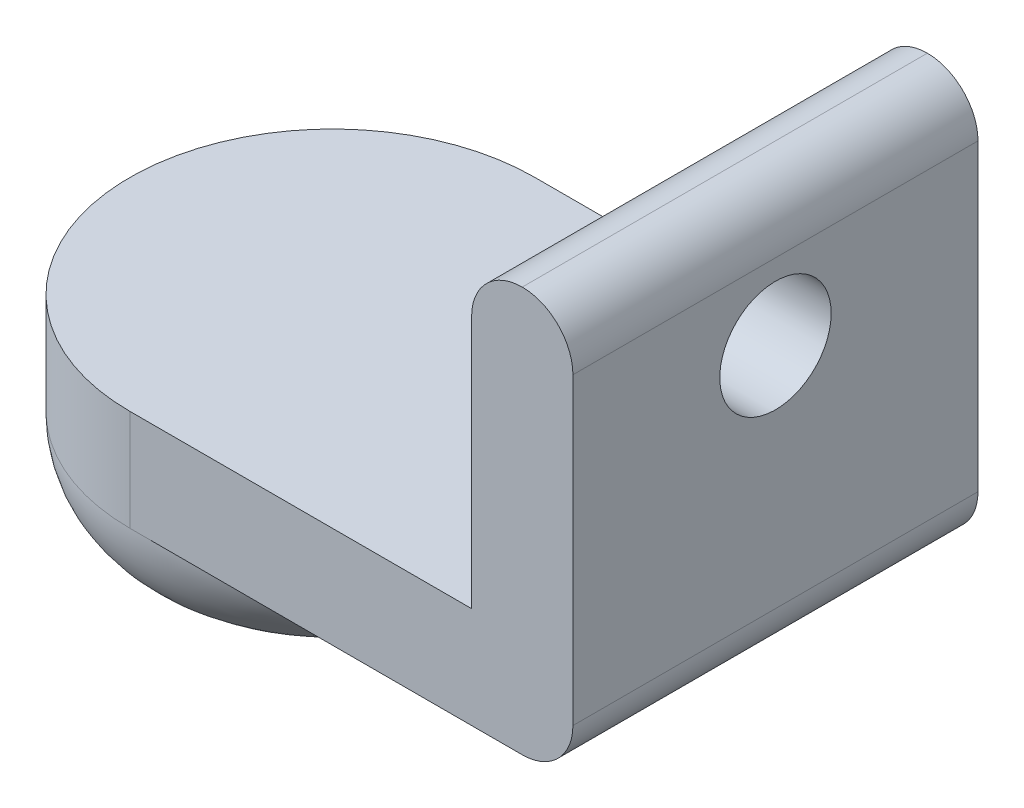
from build123d import *

# Parameters (mm, degrees)
SKETCH_1_R          = 2.525
EXTRUDE_1_DEPTH     = 2
EXTRUDE_START       = -2
SKETCH_2_R          = 2.525
EXTRUDE_2_DEPTH     = 2
SKETCH_3_R          = 4
EXTRUDE_3_DEPTH     = 2
EXTRUDE_6_DEPTH     = 8
SKETCH_11_R         = 1.05
CUT_EXTRUDE_1_DEPTH = 28.51931143
FILLET_3_R          = 1
SKETCH_12_W         = 8
SKETCH_12_H         = 5.5
CUT_EXTRUDE_2_DEPTH = 17
SKETCH_13_W         = 2
SKETCH_13_H         = 8
EXTRUDE_7_DEPTH     = 6
FILLET_4_R          = 1
FILLET_5_R          = 1
SKETCH_14_R         = 1.1
CUT_EXTRUDE_3_DEPTH = 10


with BuildPart() as part:
    # 草图1 → 凸台-拉伸1 (new body)
    with BuildSketch(Plane(origin=(0, 0, 0), x_dir=(1, 0, 0), z_dir=(0, 1, 0))):
        with BuildLine():
            Line((0, 4), (25.75, 4))
            Line((25.75, 4), (25.75, -4))
            Line((25.75, -4), (0, -4))
            ThreePointArc((0, -4), (-4, 0), (0, 4))
        make_face()
        with Locations(Location((0, 0, 0), (0, 0, 270))):
            Circle(SKETCH_1_R, mode=Mode.SUBTRACT)
    extrude(amount=EXTRUDE_1_DEPTH)

    # 草图2 → 凸台-拉伸2 (add)
    with BuildSketch(Plane(origin=(0, 2, 0), x_dir=(1, 0, 0), z_dir=(0, 1, 0)).offset(EXTRUDE_START)):
        Circle(SKETCH_2_R)
    extrude(amount=EXTRUDE_2_DEPTH)

    # 草图3 → 凸台-拉伸3 (add)
    with BuildSketch(Plane(origin=(0, 0, 0), x_dir=(1, 0, 0), z_dir=(0, 1, 0)).offset(EXTRUDE_START)):
        with Locations(Location((0, 0, 0), (0, 0, 270))):
            Circle(SKETCH_3_R)
    extrude(amount=EXTRUDE_3_DEPTH)

    # 圆角2: read off the stored shape, not the designer's step
    # 圆角2 outline → 圆角2 (revolve, cut)
    with BuildSketch(Plane.XY):
        with BuildLine():
            ThreePointArc((4, 0), (3.414213562, -1.414213562), (2, -2))
            Line((2, -2), (4, -2))
            Line((4, -2), (4, 0))
        make_face()
    revolve(axis=Axis((0, 0, 0), (0, 1, 0)), mode=Mode.SUBTRACT)

    # 草图10 → 凸台-拉伸6 (add)
    with BuildSketch(Plane(origin=(0, 0, -4), x_dir=(-1, 0, 0), z_dir=(0, 0, -1))):
        with BuildLine():
            Line((-25.75, 2), (-25.75, 4))
            ThreePointArc((-25.75, 4), (-24.25, 5.5), (-22.75, 4))
            Line((-22.75, 4), (-22.75, 2))
            Line((-22.75, 2), (-25.75, 2))
        make_face()
        with BuildLine():
            Line((-18.75, 2), (-15.75, 2))
            Line((-15.75, 2), (-15.75, 4))
            ThreePointArc((-15.75, 4), (-17.25, 5.5), (-18.75, 4))
            Line((-18.75, 4), (-18.75, 2))
        make_face()
    extrude(amount=-EXTRUDE_6_DEPTH)

    # 草图11 → 切除-拉伸1 (cut, through all)
    with BuildSketch(Plane(origin=(0, 0, -4), x_dir=(-1, 0, 0), z_dir=(0, 0, -1))):
        with Locations((-17.25, 4)):
            Circle(SKETCH_11_R)
        with Locations((-24.25, 4)):
            Circle(SKETCH_11_R)
    extrude(amount=-CUT_EXTRUDE_1_DEPTH, mode=Mode.SUBTRACT)

    # 圆角3
    fillet_3_edges = [part.edges().sort_by_distance(p)[0] for p in [
        (25.75, 0, 0),
    ]]
    fillet(fillet_3_edges, radius=FILLET_3_R)

    # 草图12 → 切除-拉伸2 (cut)
    with BuildSketch(Plane(origin=(25.75, 0, 0), x_dir=(0, 0, -1), z_dir=(1, 0, 0))):
        with Locations((0, 2.75)):
            Rectangle(SKETCH_12_W, SKETCH_12_H)
    extrude(amount=-CUT_EXTRUDE_2_DEPTH, mode=Mode.SUBTRACT)

    # 草图13 → 凸台-拉伸7 (add)
    with BuildSketch(Plane(origin=(0, 2, 0), x_dir=(1, 0, 0), z_dir=(0, 1, 0))):
        with Locations((7.75, 0)):
            Rectangle(SKETCH_13_W, SKETCH_13_H)
    extrude(amount=EXTRUDE_7_DEPTH)

    # 圆角4
    fillet_4_edges = [part.edges().sort_by_distance(p)[0] for p in [
        (8.75, 0, 0),
    ]]
    fillet(fillet_4_edges, radius=FILLET_4_R)

    # 圆角5
    fillet_5_edges = [part.edges().sort_by_distance(p)[0] for p in [
        (6.75, 8, 0),
        (8.75, 8, 0),
    ]]
    fillet(fillet_5_edges, radius=FILLET_5_R - 0.0001)  # a hair under: the kernel refuses the full size

    # 草图14 → 切除-拉伸3 (cut)
    with BuildSketch(Plane(origin=(8.75, 0, 0), x_dir=(0, 0, -1), z_dir=(1, 0, 0))):
        with Locations((0, 5.5)):
            Circle(SKETCH_14_R)
    extrude(amount=-CUT_EXTRUDE_3_DEPTH, mode=Mode.SUBTRACT)


solid = part.part
